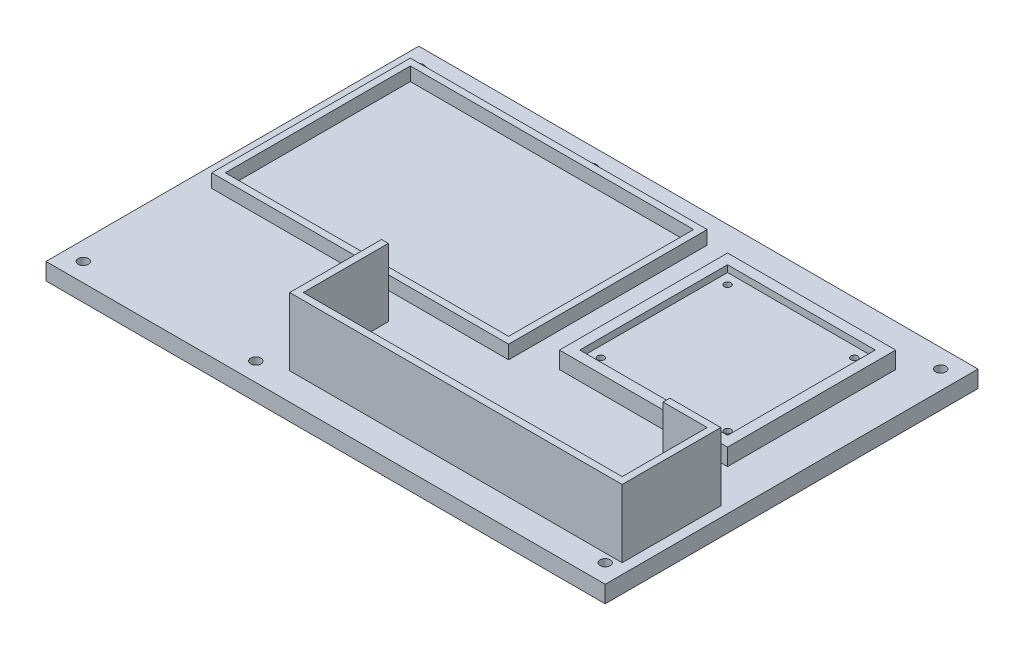
from build123d import *

# Parameters (mm, degrees)
SKETCH1_W           = 165
SKETCH1_H           = 110
BOSS_EXTRUDE1_DEPTH = 5
SKETCH4_R           = 1.5
CUT_EXTRUDE1_DEPTH  = 10
BOSS_EXTRUDE2_DEPTH = 20
SKETCH7_W           = 43.6
SKETCH7_H           = 43.6
BOSS_EXTRUDE3_DEPTH = 3
SKETCH7_3_W         = 49.6
SKETCH7_3_H         = 49.6
SKETCH7_3_W_2       = 43.6
SKETCH7_3_H_2       = 43.6
BOSS_EXTRUDE4_DEPTH = 5
SKETCH8_W           = 87.6
SKETCH8_H           = 58.6
SKETCH8_W_2         = 83.6
SKETCH8_H_2         = 54.6
BOSS_EXTRUDE5_DEPTH = 4
SKETCH9_R           = 1.5
CUT_EXTRUDE2_DEPTH  = 5
SKETCH10_R          = 1
CUT_EXTRUDE3_DEPTH  = 101.599453279


with BuildPart() as part:
    # Sketch1 → Boss-Extrude1 (new body)
    with BuildSketch(Plane(origin=(0, 0, 0), x_dir=(1, 0, 0), z_dir=(0, 1, 0))):
        Rectangle(SKETCH1_W, SKETCH1_H)
    extrude(amount=BOSS_EXTRUDE1_DEPTH)

    # Sketch4 → Cut-Extrude1 (cut)
    with BuildSketch(Plane(origin=(0, 5, 0), x_dir=(1, 0, 0), z_dir=(0, 1, 0))):
        with Locations((77, 49.5)):
            Circle(SKETCH4_R)
        with Locations((-77, 49.5)):
            Circle(SKETCH4_R)
        with Locations((-77, -49.5)):
            Circle(SKETCH4_R)
        with Locations((77, -49.5)):
            Circle(SKETCH4_R)
    extrude(amount=-CUT_EXTRUDE1_DEPTH, mode=Mode.SUBTRACT)

    # Sketch5 → Boss-Extrude2 (add)
    with BuildSketch(Plane(origin=(0, 5, 0), x_dir=(1, 0, 0), z_dir=(0, 1, 0))):
        Polygon((77.5, -19.9), (77.5, -45), (-16.6, -45), (-16.6, -19.9), (-18.6, -19.9), (-18.6, -47), (79.5, -47), (79.5, -17.9), (64.5, -17.9), (64.5, -19.9), align=None)
    extrude(amount=BOSS_EXTRUDE2_DEPTH)

    # Sketch7 → Boss-Extrude3 (add)
    with BuildSketch(Plane(origin=(0, 5, 0), x_dir=(1, 0, 0), z_dir=(0, 1, 0))):
        with Locations((45.7, 17.9)):
            Rectangle(SKETCH7_W, SKETCH7_H)
    extrude(amount=BOSS_EXTRUDE3_DEPTH)

    # Sketch7<3> → Boss-Extrude4 (add)
    with BuildSketch(Plane(origin=(0, 5, 0), x_dir=(1, 0, 0), z_dir=(0, 1, 0))):
        with Locations((45.7, 17.9)):
            Rectangle(SKETCH7_3_W, SKETCH7_3_H)
        with Locations((45.7, 17.9)):
            Rectangle(SKETCH7_3_W_2, SKETCH7_3_H_2, mode=Mode.SUBTRACT)
    extrude(amount=BOSS_EXTRUDE4_DEPTH)

    # Sketch8 → Boss-Extrude5 (add)
    with BuildSketch(Plane(origin=(0, 5, 0), x_dir=(1, 0, 0), z_dir=(0, 1, 0))):
        with Locations((-32.9, 17.4)):
            Rectangle(SKETCH8_W, SKETCH8_H)
        with Locations((-32.9, 17.4)):
            Rectangle(SKETCH8_W_2, SKETCH8_H_2, mode=Mode.SUBTRACT)
    extrude(amount=BOSS_EXTRUDE5_DEPTH)

    # Sketch9 → Cut-Extrude2 (cut)
    with BuildSketch(Plane(origin=(0, 5, 0), x_dir=(1, 0, 0), z_dir=(0, 1, 0))):
        with Locations((-26.1, -49.5)):
            Circle(SKETCH9_R)
        with Locations((-26.1, 49.5)):
            Circle(SKETCH9_R)
    extrude(amount=-CUT_EXTRUDE2_DEPTH, mode=Mode.SUBTRACT)

    # Sketch10 → Cut-Extrude3 (cut, through all)
    with BuildSketch(Plane(origin=(0, 8, 0), x_dir=(1, 0, 0), z_dir=(0, 1, 0))):
        with Locations((27, 36.6)):
            Circle(SKETCH10_R)
        with Locations((27, -0.8)):
            Circle(SKETCH10_R)
        with Locations((64.4, -0.8)):
            Circle(SKETCH10_R)
        with Locations((64.4, 36.6)):
            Circle(SKETCH10_R)
    extrude(amount=-CUT_EXTRUDE3_DEPTH, mode=Mode.SUBTRACT)


solid = part.part
